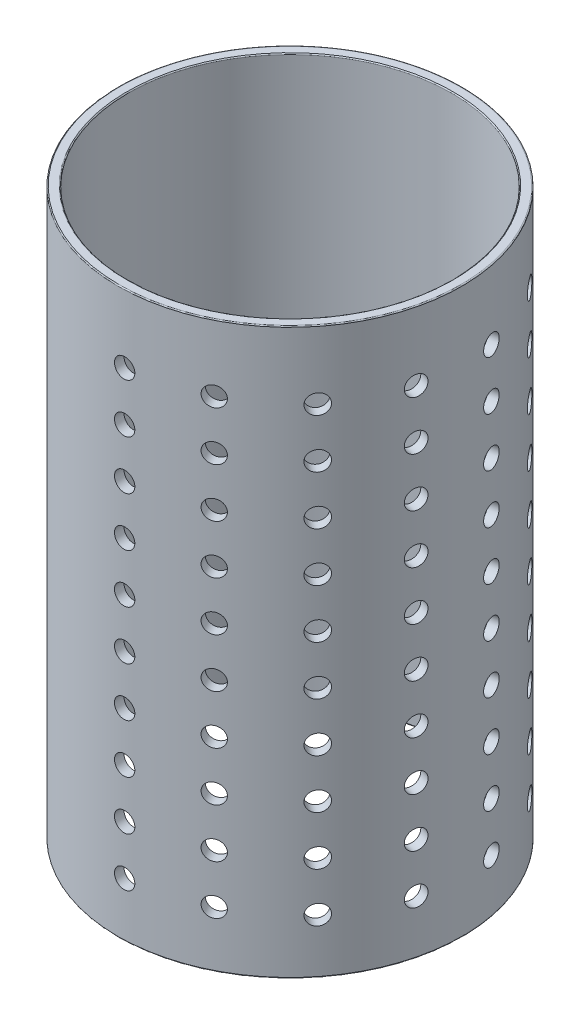
from build123d import *

# Parameters (mm, degrees)
SKETCH1_R             = 35
SKETCH1_R_2           = 33
EXTRUDE_THIN1_DEPTH   = 115
FILLET1_R             = 0.2
LPATTERN1_START       = 32.939338083
LPATTERN1_OUTLINE_R   = 2
LPATTERN1_DEPTH       = 2.060661983
LPATTERN1_2_OUTLINE_R = 2
LPATTERN1_2_DEPTH     = 2.060661983
LPATTERN1_3_OUTLINE_R = 2
LPATTERN1_3_DEPTH     = 2.060661983
LPATTERN1_4_OUTLINE_R = 2
LPATTERN1_4_DEPTH     = 2.060661983
LPATTERN1_5_OUTLINE_R = 2
LPATTERN1_5_DEPTH     = 2.060661983
LPATTERN1_6_OUTLINE_R = 2
LPATTERN1_6_DEPTH     = 2.060661983


# Read off the part's stored shape, not the designer's step: LPattern1
with BuildPart() as part:
    # Sketch1 → Extrude-Thin1 (new body)
    with BuildSketch(Plane(origin=(0, 0, 0), x_dir=(1, 0, 0), z_dir=(0, 1, 0))):
        Circle(SKETCH1_R)
        Circle(SKETCH1_R_2, mode=Mode.SUBTRACT)
    extrude(amount=EXTRUDE_THIN1_DEPTH)

    # Fillet1
    fillet1_edges = [part.edges().sort_by_distance(p)[0] for p in [
        (-35, 0, 0),
        (-33, 0, 0),
        (-35, 115, 0),
        (-33, 115, 0),
    ]]
    fillet(fillet1_edges, radius=FILLET1_R)

    # Sketch4 → Ø4.0 (4) Diameter Hole1 (revolve, cut)
    with BuildSketch(Plane(origin=(15.794786971, 11.395974576, 31.233390859), x_dir=(0.8923825959717814, 0, -0.4512796277328109), z_dir=(0, 1, 0))):
        Polygon((0, 0), (0, 3.701721238), (2, 2.5), (2, 0), align=None)
    revolve(axis=Axis((18.660412607, 11.395974576, 36.900020343), (-0.4512796277328109, 0, -0.8923825959717814)), mode=Mode.SUBTRACT)

    # Sketch4 at point 2 (carried to point 2, square into its face) → Ø4.0 (4) Diameter Hole1 at 2 (revolve, cut)
    with BuildSketch(Plane(origin=(27.417208566, 11.101565421, 21.755382655), x_dir=(0.62158205, 0, -0.783349063), z_dir=(0, 1, 0))):
        Polygon((0, 0), (0, 3.701721238), (2, 2.5), (2, 0), align=None)
    revolve(axis=Axis((32.391475117, 11.101565421, 25.702428674), (-0.783349063, 0, -0.62158205)), mode=Mode.SUBTRACT)

    # Sketch4 at point 3 (carried to point 3, square into its face) → Ø4.0 (4) Diameter Hole1 at 3 (revolve, cut)
    with BuildSketch(Plane(origin=(34.006225239, 10.932416411, 8.281101676), x_dir=(0.236603095, 0, -0.971606389), z_dir=(0, 1, 0))):
        Polygon((0, 0), (0, 3.701721238), (2, 2.5), (2, 0), align=None)
    revolve(axis=Axis((40.175925811, 10.932416411, 9.783531328), (-0.971606389, 0, -0.236603095)), mode=Mode.SUBTRACT)

    # Sketch4 at point 4 (carried to point 4, square into its face) → Ø4.0 (4) Diameter Hole1 at 4 (revolve, cut)
    with BuildSketch(Plane(origin=(28.385188917, 11.017213054, -20.476353439), x_dir=(-0.585039076, 0, -0.811005105), z_dir=(0, 1, 0))):
        Polygon((0, 0), (0, 3.701721238), (2, 2.5), (2, 0), align=None)
    revolve(axis=Axis((33.535071332, 11.017213054, -24.191351569), (-0.811005105, 0, 0.585039076)), mode=Mode.SUBTRACT)

    # Sketch4 at point 5 (carried to point 5, square into its face) → Ø4.0 (4) Diameter Hole1 at 5 (revolve, cut)
    with BuildSketch(Plane(origin=(1.273732887, 11.041344953, 34.976815243), x_dir=(0.999337592, 0, -0.036391985), z_dir=(0, 1, 0))):
        Polygon((0, 0), (0, 3.701721238), (2, 2.5), (2, 0), align=None)
    revolve(axis=Axis((1.504821992, 11.041344953, 41.322608954), (-0.036391985, 0, -0.999337592)), mode=Mode.SUBTRACT)

    # Sketch4 at point 6 (carried to point 6, square into its face) → Ø4.0 (4) Diameter Hole1 at 6 (revolve, cut)
    with BuildSketch(Plane(origin=(34.349880614, 10.826726851, -6.714588728), x_dir=(-0.191845045, 0, -0.981425228), z_dir=(0, 1, 0))):
        Polygon((0, 0), (0, 3.701721238), (2, 2.5), (2, 0), align=None)
    revolve(axis=Axis((40.581930814, 10.826726851, -7.932804761), (-0.981425228, 0, 0.191845045)), mode=Mode.SUBTRACT)

    # LPattern1 outline → LPattern1 (cut)
    with BuildSketch(Plane(origin=(0, 0, 0), x_dir=(0, 1, 0), z_dir=(0.9814251604084728, 0, -0.19184539222301794)).offset(LPATTERN1_START)):
        with Locations((20.826726851, 0)):
            Circle(LPATTERN1_OUTLINE_R)
        with Locations((30.826726851, 0)):
            Circle(LPATTERN1_OUTLINE_R)
        with Locations((40.826726851, 0)):
            Circle(LPATTERN1_OUTLINE_R)
        with Locations((50.826726851, 0)):
            Circle(LPATTERN1_OUTLINE_R)
        with Locations((60.826726851, 0)):
            Circle(LPATTERN1_OUTLINE_R)
        with Locations((70.826726851, 0)):
            Circle(LPATTERN1_OUTLINE_R)
        with Locations((80.826726851, 0)):
            Circle(LPATTERN1_OUTLINE_R)
        with Locations((90.826726851, 0)):
            Circle(LPATTERN1_OUTLINE_R)
        with Locations((100.826726851, 0)):
            Circle(LPATTERN1_OUTLINE_R)
    extrude(amount=LPATTERN1_DEPTH, mode=Mode.SUBTRACT)

    # LPattern1 2 outline → LPattern1 2 (cut)
    with BuildSketch(Plane(origin=(0, 0, 0), x_dir=(0.9993375783676385, 0, -0.036392368187628796), z_dir=(0.03639236818762879, 0, 0.9993375783676386)).offset(LPATTERN1_START)):
        with Locations((0, 21.041344953)):
            Circle(LPATTERN1_2_OUTLINE_R)
        with Locations((0, 31.041344953)):
            Circle(LPATTERN1_2_OUTLINE_R)
        with Locations((0, 41.041344953)):
            Circle(LPATTERN1_2_OUTLINE_R)
        with Locations((0, 51.041344953)):
            Circle(LPATTERN1_2_OUTLINE_R)
        with Locations((0, 61.041344953)):
            Circle(LPATTERN1_2_OUTLINE_R)
        with Locations((0, 71.041344953)):
            Circle(LPATTERN1_2_OUTLINE_R)
        with Locations((0, 81.041344953)):
            Circle(LPATTERN1_2_OUTLINE_R)
        with Locations((0, 91.041344953)):
            Circle(LPATTERN1_2_OUTLINE_R)
        with Locations((0, 101.041344953)):
            Circle(LPATTERN1_2_OUTLINE_R)
    extrude(amount=LPATTERN1_2_DEPTH, mode=Mode.SUBTRACT)

    # LPattern1 3 outline → LPattern1 3 (cut)
    with BuildSketch(Plane(origin=(0, 0, 0), x_dir=(0.5850386696808438, 0, 0.81100539762573), z_dir=(0.81100539762573, 0, -0.585038669680844)).offset(LPATTERN1_START)):
        with Locations((0, -21.017213054)):
            Circle(LPATTERN1_3_OUTLINE_R)
        with Locations((0, -31.017213054)):
            Circle(LPATTERN1_3_OUTLINE_R)
        with Locations((0, -41.017213054)):
            Circle(LPATTERN1_3_OUTLINE_R)
        with Locations((0, -51.017213054)):
            Circle(LPATTERN1_3_OUTLINE_R)
        with Locations((0, -61.017213054)):
            Circle(LPATTERN1_3_OUTLINE_R)
        with Locations((0, -71.017213054)):
            Circle(LPATTERN1_3_OUTLINE_R)
        with Locations((0, -81.017213054)):
            Circle(LPATTERN1_3_OUTLINE_R)
        with Locations((0, -91.017213054)):
            Circle(LPATTERN1_3_OUTLINE_R)
        with Locations((0, -101.017213054)):
            Circle(LPATTERN1_3_OUTLINE_R)
    extrude(amount=LPATTERN1_3_DEPTH, mode=Mode.SUBTRACT)

    # LPattern1 4 outline → LPattern1 4 (cut)
    with BuildSketch(Plane(origin=(0, 0, 0), x_dir=(0, 1, 0), z_dir=(0.9716064354079048, 0, 0.23660290504122095)).offset(LPATTERN1_START)):
        with Locations((20.932416411, 0)):
            Circle(LPATTERN1_4_OUTLINE_R)
        with Locations((30.932416411, 0)):
            Circle(LPATTERN1_4_OUTLINE_R)
        with Locations((40.932416411, 0)):
            Circle(LPATTERN1_4_OUTLINE_R)
        with Locations((50.932416411, 0)):
            Circle(LPATTERN1_4_OUTLINE_R)
        with Locations((60.932416411, 0)):
            Circle(LPATTERN1_4_OUTLINE_R)
        with Locations((70.932416411, 0)):
            Circle(LPATTERN1_4_OUTLINE_R)
        with Locations((80.932416411, 0)):
            Circle(LPATTERN1_4_OUTLINE_R)
        with Locations((90.932416411, 0)):
            Circle(LPATTERN1_4_OUTLINE_R)
        with Locations((100.932416411, 0)):
            Circle(LPATTERN1_4_OUTLINE_R)
    extrude(amount=LPATTERN1_4_DEPTH, mode=Mode.SUBTRACT)

    # LPattern1 5 outline → LPattern1 5 (cut)
    with BuildSketch(Plane(origin=(0, 0, 0), x_dir=(0.6215823615704078, 0, -0.783348816163371), z_dir=(0.7833488161633709, 0, 0.621582361570408)).offset(LPATTERN1_START)):
        with Locations((0, 21.101565421)):
            Circle(LPATTERN1_5_OUTLINE_R)
        with Locations((0, 31.101565421)):
            Circle(LPATTERN1_5_OUTLINE_R)
        with Locations((0, 41.101565421)):
            Circle(LPATTERN1_5_OUTLINE_R)
        with Locations((0, 51.101565421)):
            Circle(LPATTERN1_5_OUTLINE_R)
        with Locations((0, 61.101565421)):
            Circle(LPATTERN1_5_OUTLINE_R)
        with Locations((0, 71.101565421)):
            Circle(LPATTERN1_5_OUTLINE_R)
        with Locations((0, 81.101565421)):
            Circle(LPATTERN1_5_OUTLINE_R)
        with Locations((0, 91.101565421)):
            Circle(LPATTERN1_5_OUTLINE_R)
        with Locations((0, 101.101565421)):
            Circle(LPATTERN1_5_OUTLINE_R)
    extrude(amount=LPATTERN1_5_DEPTH, mode=Mode.SUBTRACT)

    # LPattern1 6 outline → LPattern1 6 (cut)
    with BuildSketch(Plane(origin=(0, 0, 0), x_dir=(0.8923825959717812, 0, -0.4512796277328112), z_dir=(0.45127962773281116, 0, 0.8923825959717814)).offset(LPATTERN1_START)):
        with Locations((0, 21.395974576)):
            Circle(LPATTERN1_6_OUTLINE_R)
        with Locations((0, 31.395974576)):
            Circle(LPATTERN1_6_OUTLINE_R)
        with Locations((0, 41.395974576)):
            Circle(LPATTERN1_6_OUTLINE_R)
        with Locations((0, 51.395974576)):
            Circle(LPATTERN1_6_OUTLINE_R)
        with Locations((0, 61.395974576)):
            Circle(LPATTERN1_6_OUTLINE_R)
        with Locations((0, 71.395974576)):
            Circle(LPATTERN1_6_OUTLINE_R)
        with Locations((0, 81.395974576)):
            Circle(LPATTERN1_6_OUTLINE_R)
        with Locations((0, 91.395974576)):
            Circle(LPATTERN1_6_OUTLINE_R)
        with Locations((0, 101.395974576)):
            Circle(LPATTERN1_6_OUTLINE_R)
    extrude(amount=LPATTERN1_6_DEPTH, mode=Mode.SUBTRACT)


solid = part.part
